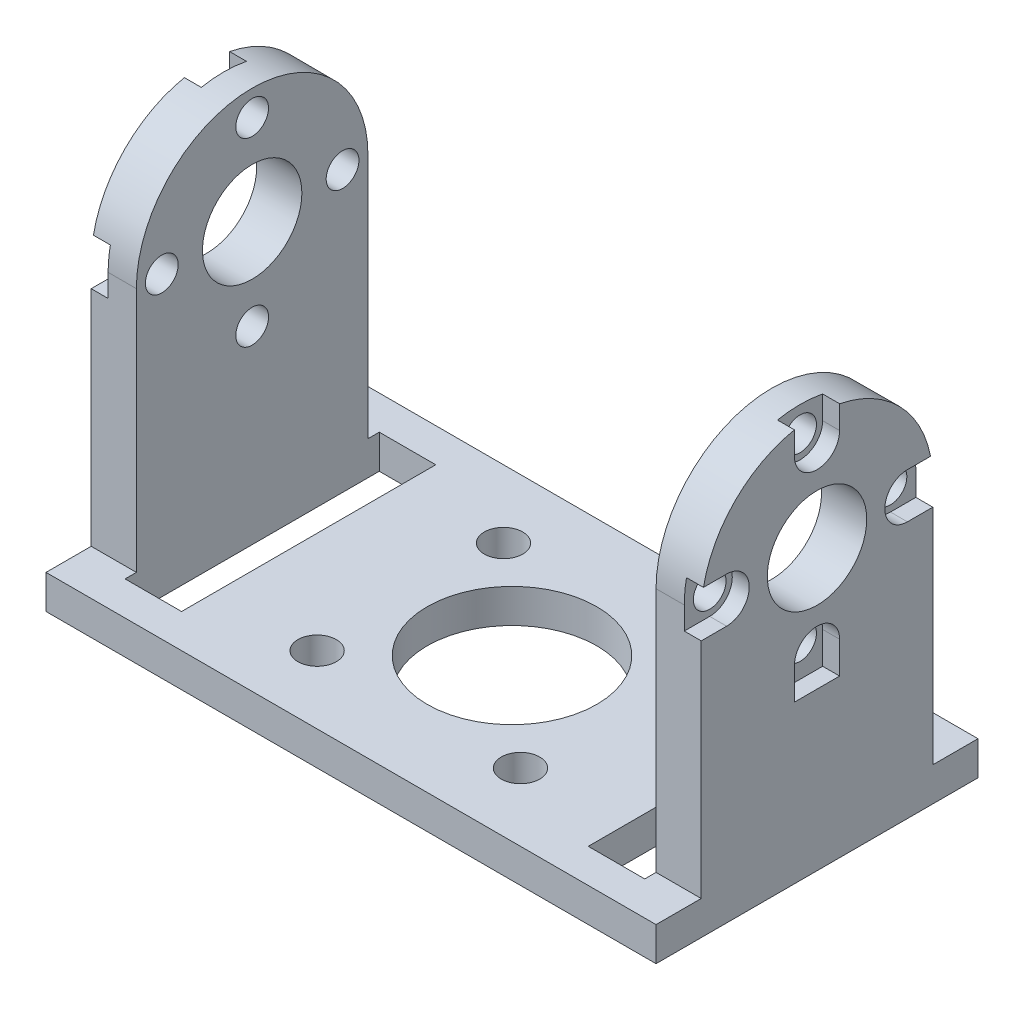
from build123d import *

# Parameters (mm, degrees)
SKETCH1_W           = 54
SKETCH1_H           = 28.5
SKETCH1_W_2         = 5
SKETCH1_H_2         = 22.5
SKETCH1_R           = 1.7
SKETCH1_R_2         = 7.5
BOSS_EXTRUDE2_DEPTH = 3
SKETCH2_W           = 4
SKETCH2_H           = 20.5
BOSS_EXTRUDE3_DEPTH = 21.75
SKETCH4_R           = 10.25
BOSS_EXTRUDE4_DEPTH = 4
SKETCH6_R           = 4.4
SKETCH6_R_2         = 1.45
CUT_EXTRUDE3_DEPTH  = 4
SKETCH7_R           = 1.45
CUT_EXTRUDE4_DEPTH  = 1.5


with BuildPart() as part:
    # Sketch1 → Boss-Extrude2 (new body)
    with BuildSketch(Plane(origin=(0, 0, 0), x_dir=(1, 0, 0), z_dir=(0, 1, 0))):
        Rectangle(SKETCH1_W, SKETCH1_H)
        with Locations((20.5, 0)):
            Rectangle(SKETCH1_W_2, SKETCH1_H_2, mode=Mode.SUBTRACT)
        with Locations((-20.5, 0)):
            Rectangle(SKETCH1_W_2, SKETCH1_H_2, mode=Mode.SUBTRACT)
        with Locations((-9, -8.25)):
            Circle(SKETCH1_R, mode=Mode.SUBTRACT)
        with Locations((9, -8.25)):
            Circle(SKETCH1_R, mode=Mode.SUBTRACT)
        with Locations((-9, 8.25)):
            Circle(SKETCH1_R, mode=Mode.SUBTRACT)
        Circle(SKETCH1_R_2, mode=Mode.SUBTRACT)
        with Locations((9, 8.25)):
            Circle(SKETCH1_R, mode=Mode.SUBTRACT)
    extrude(amount=BOSS_EXTRUDE2_DEPTH)

    # Sketch2 → Boss-Extrude3 (add)
    with BuildSketch(Plane(origin=(0, 3, 0), x_dir=(1, 0, 0), z_dir=(0, 1, 0))):
        with Locations((25, 0)):
            Rectangle(SKETCH2_W, SKETCH2_H)
    boss_extrude3 = extrude(amount=BOSS_EXTRUDE3_DEPTH)

    # Sketch4 → Boss-Extrude4 (add)
    with BuildSketch(Plane(origin=(27, 0, 0), x_dir=(0, 0, -1), z_dir=(1, 0, 0))):
        with Locations((0, 24.75)):
            Circle(SKETCH4_R)
    boss_extrude4 = extrude(amount=-BOSS_EXTRUDE4_DEPTH)

    # Mirror1: Boss-Extrude3, Boss-Extrude4 across plane
    add(boss_extrude3.mirror(Plane(origin=(0, 0, 0), x_dir=(0, 0, 1), z_dir=(1, 0, 0))))
    add(boss_extrude4.mirror(Plane(origin=(0, 0, 0), x_dir=(0, 0, 1), z_dir=(1, 0, 0))))

    # Sketch6 → Cut-Extrude3 (cut)
    with BuildSketch(Plane(origin=(27, 0, 0), x_dir=(0, 0, -1), z_dir=(1, 0, 0))):
        with Locations((0, 24.75)):
            Circle(SKETCH6_R)
        with Locations((8, 24.75)):
            Circle(SKETCH6_R_2)
        with Locations((0, 32.75)):
            Circle(SKETCH6_R_2)
        with Locations((0, 16.75)):
            Circle(SKETCH6_R_2)
        with Locations((-8, 24.75)):
            Circle(SKETCH6_R_2)
    cut_extrude3 = extrude(amount=-CUT_EXTRUDE3_DEPTH, mode=Mode.SUBTRACT)

    # Mirror3: Cut-Extrude3 across plane
    add(cut_extrude3.mirror(Plane(origin=(0, 0, 0), x_dir=(0, 0, 1), z_dir=(1, 0, 0))), mode=Mode.SUBTRACT)

    # Sketch7 → Cut-Extrude4 (cut)
    # profile 1 of 4: a face of its own
    with BuildSketch(Plane(origin=(27, 0, 0), x_dir=(0, 0, -1), z_dir=(1, 0, 0))):
        with BuildLine():
            ThreePointArc((10.25, 24.75), (10.200627247, 25.754840168), (10.052984631, 26.75))
            Line((10.052984631, 26.75), (8, 26.75))
            ThreePointArc((8, 26.75), (6, 24.75), (8, 22.75))
            Line((8, 22.75), (10.25, 22.75))
            Line((10.25, 22.75), (10.25, 24.75))
        make_face()
        with Locations((8, 24.75)):
            Circle(SKETCH7_R, mode=Mode.SUBTRACT)
    # profile 2 of 4: a face of its own
    with BuildSketch(Plane(origin=(27, 0, 0), x_dir=(0, 0, -1), z_dir=(1, 0, 0))):
        with BuildLine():
            Line((-2, 35.572359929), (-2, 32.75))
            ThreePointArc((-2, 32.75), (0, 30.75), (2, 32.75))
            Line((2, 32.75), (2, 35.572359929))
            Line((2, 35.572359929), (-2, 35.572359929))
        make_face()
        with Locations((0, 32.75)):
            Circle(SKETCH7_R, mode=Mode.SUBTRACT)
    # profile 3 of 4: a face of its own
    with BuildSketch(Plane(origin=(27, 0, 0), x_dir=(0, 0, -1), z_dir=(1, 0, 0))):
        with BuildLine():
            Line((-8, 26.75), (-10.052984631, 26.75))
            ThreePointArc((-10.052984631, 26.75), (-10.200627247, 25.754840168), (-10.25, 24.75))
            Line((-10.25, 24.75), (-10.25, 22.75))
            Line((-10.25, 22.75), (-8, 22.75))
            ThreePointArc((-8, 22.75), (-6, 24.75), (-8, 26.75))
        make_face()
        with Locations((-8, 24.75)):
            Circle(SKETCH7_R, mode=Mode.SUBTRACT)
    # profile 4 of 4: a face of its own
    with BuildSketch(Plane(origin=(27, 0, 0), x_dir=(0, 0, -1), z_dir=(1, 0, 0))):
        with BuildLine():
            ThreePointArc((2, 16.75), (0, 18.75), (-2, 16.75))
            Line((-2, 16.75), (-2, 13.927640071))
            Line((-2, 13.927640071), (2, 13.927640071))
            Line((2, 13.927640071), (2, 16.75))
        make_face()
        with Locations((0, 16.75)):
            Circle(SKETCH7_R, mode=Mode.SUBTRACT)
    cut_extrude4 = extrude(amount=-CUT_EXTRUDE4_DEPTH, mode=Mode.SUBTRACT)

    # Mirror4: Cut-Extrude4 across plane
    add(cut_extrude4.mirror(Plane(origin=(0, 0, 0), x_dir=(0, 0, 1), z_dir=(1, 0, 0))), mode=Mode.SUBTRACT)


solid = part.part
